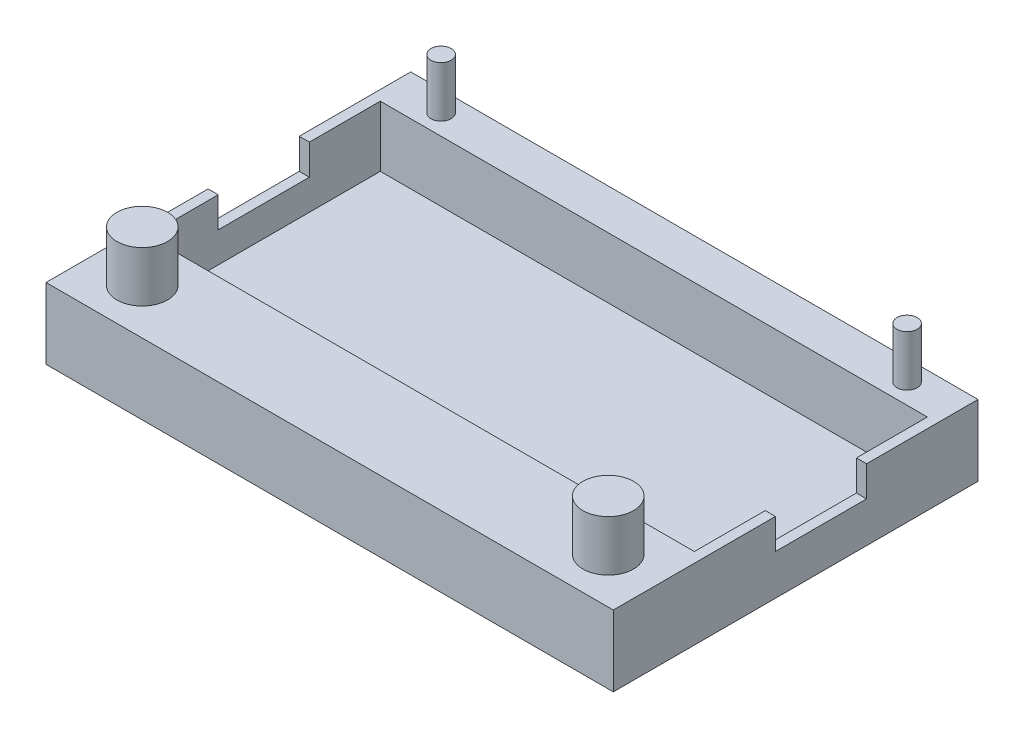
from build123d import *

# Parameters (mm, degrees)
SKETCH_1_W       = 56
SKETCH_1_H       = 32
EXTRUDE_1_DEPTH  = 1
SKETCH_2_W       = 56
SKETCH_2_H       = 32
SKETCH_2_W_2     = 54
SKETCH_2_H_2     = 23
EXTRUDE_3_DEPTH  = 3
EXTRUDE_7_DEPTH  = 3
SKETCH_9_W       = 56
SKETCH_9_H       = 3
EXTRUDE_9_DEPTH  = 7
SKETCH_10_W      = 56
SKETCH_10_H      = 1
EXTRUDE_10_DEPTH = 7
SKETCH_11_R      = 1
SKETCH_11_R_2    = 2.5
EXTRUDE_11_DEPTH = 5


with BuildPart() as part:
    # 草图1 → 凸台-拉伸1 (new body)
    with BuildSketch(Plane(origin=(0, 0, 0), x_dir=(1, 0, 0), z_dir=(0, 1, 0))):
        with Locations((-28, 16)):
            Rectangle(SKETCH_1_W, SKETCH_1_H)
    extrude(amount=EXTRUDE_1_DEPTH)

    # 草图2 → 凸台-拉伸3 (add)
    with BuildSketch(Plane(origin=(0, 1, 0), x_dir=(1, 0, 0), z_dir=(0, 1, 0))):
        with Locations((-28, 16)):
            Rectangle(SKETCH_2_W, SKETCH_2_H)
        with Locations((-28, 19.5)):
            Rectangle(SKETCH_2_W_2, SKETCH_2_H_2, mode=Mode.SUBTRACT)
    extrude(amount=EXTRUDE_3_DEPTH)

    # 草图5 → 凸台-拉伸7 (add)
    with BuildSketch(Plane(origin=(0, 4, 0), x_dir=(1, 0, 0), z_dir=(0, 1, 0))):
        Polygon((-56, 15), (-56, 0), (0, 0), (0, 15), (-1, 15), (-1, 8), (-55, 8), (-55, 15), align=None)
        Polygon((-56, 32), (-56, 24), (-55, 24), (-55, 31), (-1, 31), (-1, 24), (0, 24), (0, 32), align=None)
    extrude(amount=EXTRUDE_7_DEPTH)

    # 草图9 → 凸台-拉伸9 (add)
    with BuildSketch(Plane(origin=(0, 0, 0), x_dir=(1, 0, 0), z_dir=(0, 1, 0))):
        with Locations((-28, 33.5)):
            Rectangle(SKETCH_9_W, SKETCH_9_H)
    extrude(amount=EXTRUDE_9_DEPTH)

    # 草图10 → 凸台-拉伸10 (add)
    with BuildSketch(Plane(origin=(0, 0, 0), x_dir=(1, 0, 0), z_dir=(0, 1, 0))):
        with Locations((-28, -0.5)):
            Rectangle(SKETCH_10_W, SKETCH_10_H)
    extrude(amount=EXTRUDE_10_DEPTH)

    # 草图11 → 凸台-拉伸11 (add)
    with BuildSketch(Plane(origin=(0, 7, 0), x_dir=(1, 0, 0), z_dir=(0, 1, 0))):
        with Locations((-51, 33)):
            Circle(SKETCH_11_R)
        with Locations((-5, 33)):
            Circle(SKETCH_11_R)
        with Locations((-51, 3.5)):
            Circle(SKETCH_11_R_2)
        with Locations((-5, 3.5)):
            Circle(SKETCH_11_R_2)
    extrude(amount=EXTRUDE_11_DEPTH)


solid = part.part
